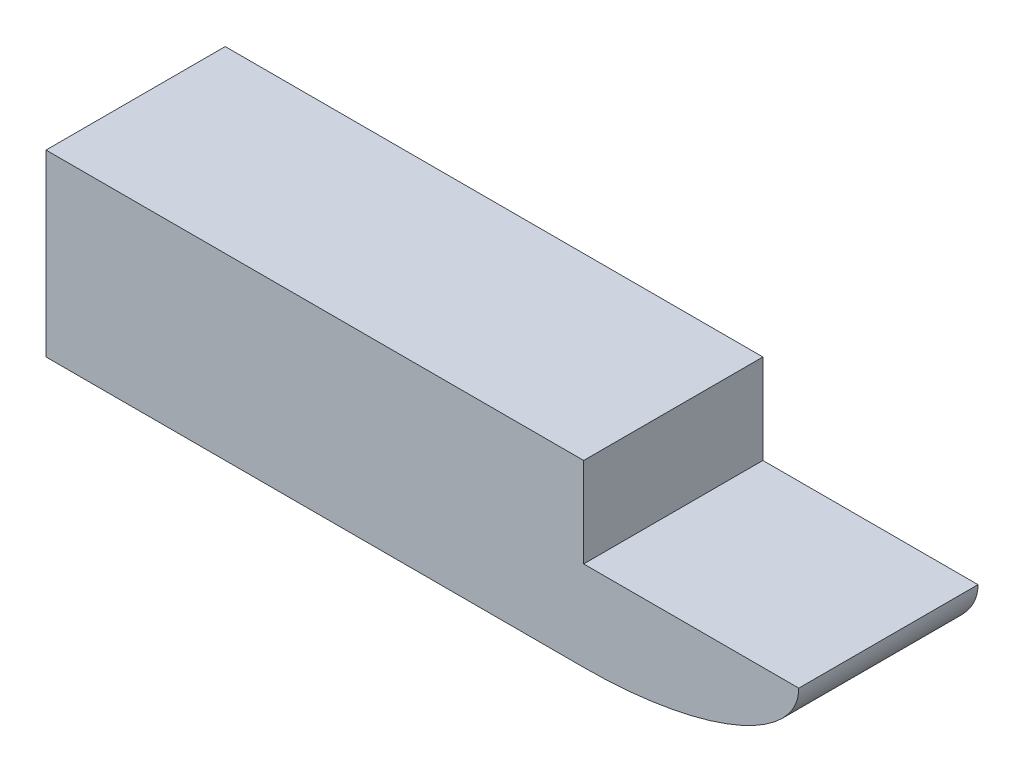
from build123d import *

# Parameters (mm, degrees)
SKETCH1_W           = 914.4
SKETCH1_H           = 304.8
BOSS_EXTRUDE1_DEPTH = 152.4
BOSS_EXTRUDE2_DEPTH = 304.8


with BuildPart() as part:
    # Sketch1 → Boss-Extrude1 (new, symmetric)
    with BuildSketch(Plane.XY):
        Rectangle(SKETCH1_W, SKETCH1_H)
    extrude(amount=BOSS_EXTRUDE1_DEPTH, both=True)

    # Sketch2 → Boss-Extrude2 (add)
    with BuildSketch(Plane.XY.offset(152.4)):
        with BuildLine():
            Line((823.002353043, 0), (457.2, 0))
            Line((457.2, 0), (457.2, -152.4))
            add(Edge.make_bspline(
                [(457.2, -152.4), (823.002353043, -152.4), (823.002353043, 0)],
                knots=[1.570796327, 1.570796327, 1.570796327, 3.141592654, 3.141592654, 3.141592654], degree=2, weights=[1, 0.707106781, 1]))
        make_face()
    extrude(amount=-BOSS_EXTRUDE2_DEPTH)


solid = part.part
